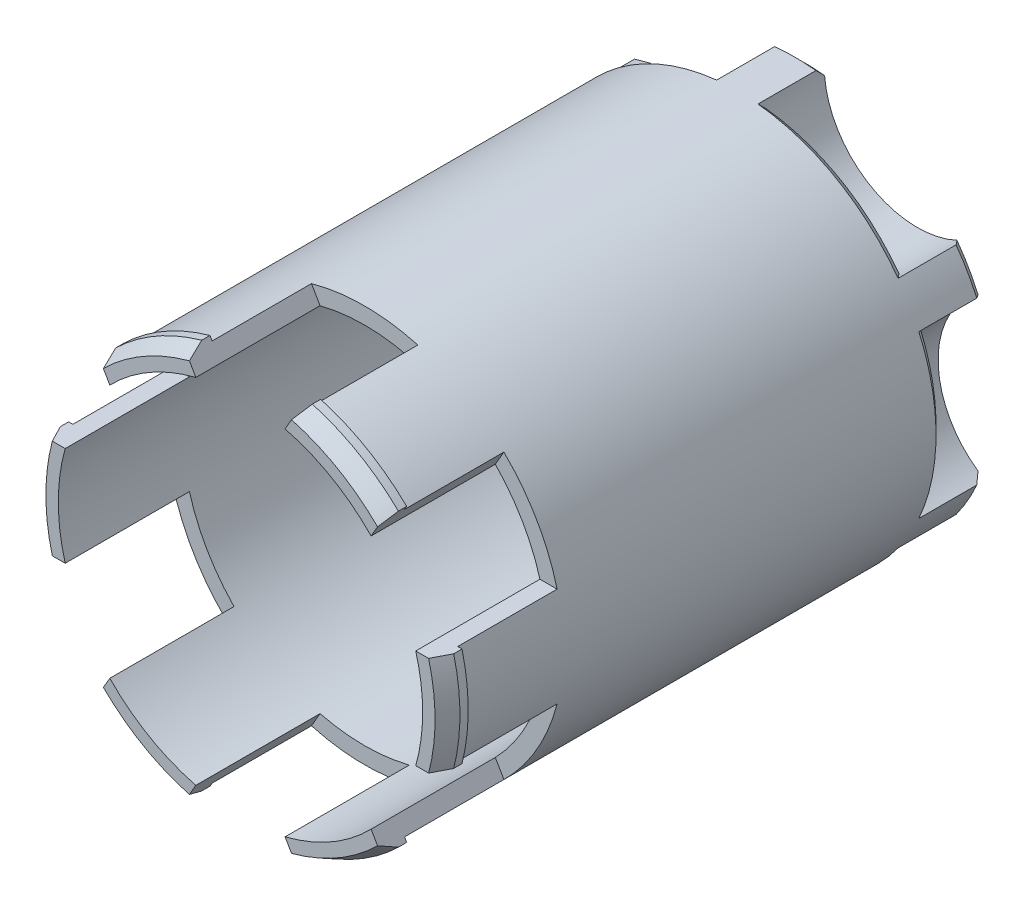
from build123d import *

# Parameters (mm, degrees)
BOSS_EXTRUDE1_DEPTH      = 2.9999999999999933
BOSS_EXTRUDE1_DEPTH_BACK = 43
BOSS_EXTRUDE2_START      = -43
SKETCH1_5_R              = 22.000000000000007
BOSS_EXTRUDE2_DEPTH      = 2
BOSS_EXTRUDE4_START      = -48
BOSS_EXTRUDE4_DEPTH      = 5
BOSS_EXTRUDE5_START      = -50
BOSS_EXTRUDE5_DEPTH      = 2
CHAMFER1_SIZE            = 1
BOSS_EXTRUDE6_START      = 3
BOSS_EXTRUDE6_DEPTH      = 15
BOSS_EXTRUDE7_START      = 15
BOSS_EXTRUDE7_DEPTH      = 3
CHAMFER2_SIZE            = 2
CHAMFER2_SIZE_2          = 1


with BuildPart() as part:
    # Sketch1 → Boss-Extrude1 (new, two sides: drawn at the far end of the back side and taken through both)
    with BuildSketch(Plane.XY.offset(-BOSS_EXTRUDE1_DEPTH_BACK)):
        with BuildLine():
            ThreePointArc((20.24886363636362, 8.601367416635062), (20.748246379007643, 7.315071578323524), (21.166010488516733, 6.000000000000002))
            Line((21.16601048851673, 6), (23.23790007724409, 6))
            ThreePointArc((23.237900077244284, 6.000000000000867), (22.65827130919298, 7.912189411218785), (21.921590909090916, 9.769536939612994))
            ThreePointArc((21.921590909090916, 9.769536939612994), (21.05869080456737, 9.223450322348732), (20.248863636363723, 8.601367416635078))
        make_face()
        with BuildLine():
            Line((23.23790007724409, 6), (21.16601048851673, 6))
            ThreePointArc((21.166010488516733, 6.000000000000002), (21.79050516563772, 3.0288421263439984), (22.000000000000007, 0))
            ThreePointArc((22.000000000000007, -5.39e-15), (21.79050516563772, -3.028842126344007), (21.16601048851673, -6.000000000000013))
            Line((21.16601048851673, -6), (23.23790007724408, -6))
            ThreePointArc((23.237900077244277, -6.000000000000899), (23.80871271041195, -3.0241030195859375), (24.000000000000007, -5.88e-15))
            ThreePointArc((24.000000000000007, 0), (23.808712710411953, 3.0241030195859184), (23.237900077244284, 6.000000000000867))
        make_face()
        with BuildLine():
            Line((23.23790007724408, -6), (21.16601048851673, -6))
            ThreePointArc((21.16601048851673, -6.000000000000013), (20.74824637900764, -7.3150715783235265), (20.248863636363623, -8.601367416635055))
            ThreePointArc((20.248863636363723, -8.601367416635075), (21.058690804567362, -9.223450322348729), (21.921590909090916, -9.769536939612994))
            ThreePointArc((21.921590909090913, -9.769536939613007), (22.65827130919297, -7.912189411218819), (23.237900077244277, -6.000000000000899))
        make_face()
        with BuildLine():
            ThreePointArc((21.921590909090916, -9.769536939612994), (21.058690804567362, -9.223450322348729), (20.248863636363723, -8.601367416635075))
            ThreePointArc((20.248863636363623, -8.601367416635055), (19.825043296442324, -9.53769669753592), (19.357954545454554, -10.453209833162045))
            ThreePointArc((19.357954545454554, -10.453209833162045), (19.05255888325766, -10.999999999999996), (18.7317225393349, -11.53787548508707))
            ThreePointArc((18.7317225393349, -11.53787548508707), (18.172409281878213, -12.400142777077484), (17.57343450827152, -13.23534659854029))
            ThreePointArc((17.573434508271625, -13.235346598540406), (18.517087691981484, -13.625636046022741), (19.42146262746079, -14.099886148836239))
            ThreePointArc((19.421462627460784, -14.099886148836251), (20.784609690826528, -12.000000000000014), (21.921590909090913, -9.769536939613007))
        make_face()
        with BuildLine():
            ThreePointArc((16.81510246132865, -17.124611797498346), (18.181292684265788, -15.666543853992295), (19.421462627460784, -14.099886148836251))
            ThreePointArc((19.42146262746079, -14.099886148836239), (18.517087691981484, -13.625636046022741), (17.573434508271625, -13.235346598540406))
            ThreePointArc((17.57343450827152, -13.23534659854029), (16.709161006833533, -14.310972659037333), (15.779157666964993, -15.330302779823374))
            Line((15.779157666964998, -15.33030277982336), (16.815102461328966, -17.12461179749825))
        make_face()
        with BuildLine():
            ThreePointArc((6.422797615915619, -23.124611797498115), (11.999999999999858, -20.784609690826617), (16.81510246132865, -17.124611797498346))
            Line((16.815102461328966, -17.12461179749825), (15.779157666964998, -15.33030277982336))
            ThreePointArc((15.779157666964993, -15.330302779823374), (10.99999999999999, -19.052558883257664), (5.386852821551727, -21.330302779823366))
            Line((5.386852821551734, -21.330302779823363), (6.422797615915627, -23.124611797498115))
        make_face()
        with BuildLine():
            ThreePointArc((5.386852821551727, -21.330302779823366), (4.039085372174182, -21.62604423736086), (2.6754291280922486, -21.836714015175357))
            ThreePointArc((2.675429128092201, -21.83671401517523), (2.541603112585925, -22.84908636837134), (2.500128281630129, -23.869423088449235))
            ThreePointArc((2.50012828163012, -23.86942308844924), (4.476978624927215, -23.57873326521052), (6.422797615915619, -23.124611797498115))
            Line((6.422797615915627, -23.124611797498115), (5.386852821551734, -21.330302779823363))
        make_face()
        with BuildLine():
            ThreePointArc((2.6754291280922486, -21.836714015175357), (1.6526340145641762, -21.937839474613394), (0.6262320061196591, -21.991085318249112))
            ThreePointArc((0.6262320061196591, -21.991085318249112), (-4.04e-15, -22.000000000000007), (-0.6262320061196476, -21.991085318249112))
            ThreePointArc((-0.6262320061196476, -21.991085318249112), (-1.6526340145641842, -21.937839474613394), (-2.6754291280922375, -21.83671401517536))
            ThreePointArc((-2.675429128092187, -21.836714015175232), (-2.541603112585914, -22.84908636837135), (-2.5001282816301167, -23.869423088449242))
            ThreePointArc((-2.5001282816301282, -23.869423088449235), (-4.41e-15, -24.000000000000007), (2.50012828163012, -23.86942308844924))
            ThreePointArc((2.500128281630129, -23.869423088449235), (2.541603112585925, -22.84908636837134), (2.675429128092201, -21.83671401517523))
        make_face()
        with BuildLine():
            ThreePointArc((-2.5001282816301167, -23.869423088449242), (-2.541603112585914, -22.84908636837135), (-2.675429128092187, -21.836714015175232))
            ThreePointArc((-2.6754291280922375, -21.83671401517536), (-4.03908537217419, -21.62604423736086), (-5.386852821551735, -21.330302779823366))
            Line((-5.386852821551729, -21.330302779823366), (-6.422797615915622, -23.124611797498122))
            ThreePointArc((-6.422797615915628, -23.124611797498112), (-4.476978624927224, -23.57873326521052), (-2.5001282816301282, -23.869423088449235))
        make_face()
        with BuildLine():
            ThreePointArc((-16.815102461328664, -17.124611797498336), (-11.999999999999865, -20.784609690826613), (-6.422797615915628, -23.124611797498112))
            Line((-6.422797615915622, -23.124611797498122), (-5.386852821551729, -21.330302779823366))
            ThreePointArc((-5.386852821551735, -21.330302779823366), (-10.999999999999995, -19.05255888325766), (-15.779157666964997, -15.330302779823368))
            Line((-15.779157666964991, -15.330302779823372), (-16.81510246132896, -17.12461179749825))
        make_face()
        with BuildLine():
            ThreePointArc((-15.779157666964997, -15.330302779823368), (-16.709161006833533, -14.310972659037335), (-17.573434508271525, -13.23534659854028))
            ThreePointArc((-17.573434508271625, -13.235346598540415), (-18.517087691981477, -13.625636046022748), (-19.42146262746078, -14.099886148836244))
            ThreePointArc((-19.42146262746079, -14.099886148836244), (-18.181292684265806, -15.666543853992271), (-16.815102461328664, -17.124611797498336))
            Line((-16.81510246132896, -17.12461179749825), (-15.779157666964991, -15.330302779823372))
        make_face()
        with BuildLine():
            ThreePointArc((-17.573434508271525, -13.23534659854028), (-18.17240928187822, -12.40014277707747), (-18.731722539334903, -11.537875485087064))
            ThreePointArc((-18.731722539334903, -11.537875485087064), (-19.052558883257657, -11.000000000000005), (-19.357954545454554, -10.453209833162047))
            ThreePointArc((-19.357954545454554, -10.453209833162047), (-19.825043296442328, -9.537696697535912), (-20.24886363636362, -8.601367416635066))
            ThreePointArc((-20.248863636363723, -8.601367416635082), (-21.058690804567366, -9.223450322348736), (-21.921590909090916, -9.769536939612998))
            ThreePointArc((-21.92159090909092, -9.76953693961299), (-20.78460969082653, -12.000000000000007), (-19.42146262746079, -14.099886148836244))
            ThreePointArc((-19.42146262746078, -14.099886148836244), (-18.517087691981477, -13.625636046022748), (-17.573434508271625, -13.235346598540415))
        make_face()
        with BuildLine():
            Line((-21.16601048851673, -6.000000000000003), (-23.237900077244564, -6.000000000000003))
            ThreePointArc((-23.23790007724454, -5.999999999999878), (-22.658271309193147, -7.912189411218307), (-21.92159090909092, -9.76953693961299))
            ThreePointArc((-21.921590909090916, -9.769536939612998), (-21.058690804567366, -9.223450322348736), (-20.248863636363723, -8.601367416635082))
            ThreePointArc((-20.24886363636362, -8.601367416635066), (-20.74824637900764, -7.315071578323528), (-21.16601048851673, -6.000000000000006))
        make_face()
        with BuildLine():
            Line((-21.16601048851673, 5.999999999999997), (-23.237900077244568, 5.999999999999997))
            ThreePointArc((-23.23790007724454, 5.9999999999998845), (-24.000000000000007, 2.94e-15), (-23.23790007724454, -5.999999999999878))
            Line((-23.237900077244564, -6.000000000000003), (-21.16601048851673, -6.000000000000003))
            ThreePointArc((-21.16601048851673, -6.000000000000006), (-22.000000000000007, 2.69e-15), (-21.166010488516733, 6.000000000000002))
        make_face()
        with BuildLine():
            ThreePointArc((-21.921590909090916, 9.769536939612996), (-22.658271309193143, 7.912189411218312), (-23.23790007724454, 5.9999999999998845))
            Line((-23.237900077244568, 5.999999999999997), (-21.16601048851673, 5.999999999999997))
            ThreePointArc((-21.166010488516733, 6.000000000000002), (-20.748246379007643, 7.315071578323524), (-20.24886363636362, 8.60136741663506))
            ThreePointArc((-20.248863636363726, 8.601367416635076), (-21.05869080456737, 9.223450322348729), (-21.921590909090916, 9.76953693961299))
        make_face()
        with BuildLine():
            ThreePointArc((-19.357954545454554, 10.453209833162044), (-19.052558883257664, 10.999999999999993), (-18.73172253933491, 11.537875485087051))
            ThreePointArc((-18.73172253933491, 11.537875485087051), (-18.172409281878224, 12.400142777077468), (-17.57343450827153, 13.235346598540279))
            ThreePointArc((-17.57343450827163, 13.235346598540403), (-18.51708769198149, 13.625636046022736), (-19.421462627460798, 14.099886148836234))
            ThreePointArc((-19.421462627460798, 14.099886148836234), (-20.78460969082654, 11.999999999999993), (-21.921590909090916, 9.769536939612996))
            ThreePointArc((-21.921590909090916, 9.76953693961299), (-21.05869080456737, 9.223450322348729), (-20.248863636363726, 8.601367416635076))
            ThreePointArc((-20.24886363636362, 8.60136741663506), (-19.825043296442324, 9.537696697535917), (-19.357954545454554, 10.453209833162044))
        make_face()
        with BuildLine():
            Line((-15.779157666965002, 15.33030277982336), (-16.81510246132897, 17.12461179749824))
            ThreePointArc((-16.815102461328664, 17.12461179749833), (-18.18129268426581, 15.666543853992268), (-19.421462627460798, 14.099886148836234))
            ThreePointArc((-19.421462627460798, 14.099886148836234), (-18.51708769198149, 13.625636046022736), (-17.57343450827163, 13.235346598540403))
            ThreePointArc((-17.57343450827153, 13.235346598540279), (-16.709161006833533, 14.310972659037333), (-15.779157666965, 15.330302779823363))
        make_face()
        with BuildLine():
            Line((-5.386852821551742, 21.330302779823363), (-6.42279761591554, 23.124611797497952))
            ThreePointArc((-6.4227976159152576, 23.124611797498215), (-11.999999999999703, 20.784609690826706), (-16.815102461328664, 17.12461179749833))
            Line((-16.81510246132897, 17.12461179749824), (-15.779157666965002, 15.33030277982336))
            ThreePointArc((-15.779157666965, 15.330302779823363), (-11.000000000000009, 19.052558883257653), (-5.386852821551744, 21.330302779823363))
        make_face()
        with BuildLine():
            ThreePointArc((-2.500128281630133, 23.869423088449235), (-4.47697862492704, 23.578733265210552), (-6.4227976159152576, 23.124611797498215))
            Line((-6.42279761591554, 23.124611797497952), (-5.386852821551742, 21.330302779823363))
            ThreePointArc((-5.386852821551744, 21.330302779823363), (-4.039085372174195, 21.62604423736086), (-2.675429128092256, 21.836714015175357))
            ThreePointArc((-2.6754291280922082, 21.836714015175225), (-2.541603112585932, 22.849086368371346), (-2.5001282816301362, 23.869423088449242))
        make_face()
        with BuildLine():
            ThreePointArc((-0.6262320061196618, 21.991085318249112), (-1.819e-14, 22.000000000000007), (0.6262320061196303, 21.991085318249112))
            ThreePointArc((0.6262320061196303, 21.991085318249112), (1.6526340145641618, 21.937839474613398), (2.6754291280922247, 21.83671401517536))
            ThreePointArc((2.6754291280921745, 21.836714015175232), (2.5416031125859018, 22.849086368371346), (2.5001282816301043, 23.86942308844924))
            ThreePointArc((2.5001282816301043, 23.86942308844924), (-1.452e-14, 24.000000000000007), (-2.500128281630133, 23.869423088449235))
            ThreePointArc((-2.5001282816301362, 23.869423088449242), (-2.541603112585932, 22.849086368371346), (-2.6754291280922082, 21.836714015175225))
            ThreePointArc((-2.675429128092256, 21.836714015175357), (-1.6526340145641885, 21.937839474613394), (-0.6262320061196618, 21.991085318249112))
        make_face()
        with BuildLine():
            Line((5.386852821551717, 21.330302779823366), (6.422797615915513, 23.12461179749796))
            ThreePointArc((6.42279761591523, 23.124611797498222), (4.476978624927011, 23.57873326521056), (2.5001282816301043, 23.86942308844924))
            ThreePointArc((2.5001282816301043, 23.86942308844924), (2.5416031125859018, 22.849086368371346), (2.6754291280921745, 21.836714015175232))
            ThreePointArc((2.6754291280922247, 21.83671401517536), (4.039085372174168, 21.626044237360865), (5.386852821551718, 21.33030277982337))
        make_face()
        with BuildLine():
            Line((15.779157666964986, 15.330302779823379), (16.815102461328948, 17.124611797498257))
            ThreePointArc((16.815102461328642, 17.124611797498353), (11.999999999999678, 20.78460969082672), (6.42279761591523, 23.124611797498222))
            Line((6.422797615915513, 23.12461179749796), (5.386852821551717, 21.330302779823366))
            ThreePointArc((5.386852821551718, 21.33030277982337), (10.99999999999999, 19.052558883257664), (15.779157666964984, 15.33030277982338))
        make_face()
        with BuildLine():
            ThreePointArc((17.573434508271614, 13.235346598540424), (18.517087691981473, 13.625636046022757), (19.421462627460777, 14.099886148836253))
            ThreePointArc((19.421462627460784, 14.099886148836255), (18.18129268426579, 15.66654385399229), (16.815102461328642, 17.124611797498353))
            Line((16.815102461328948, 17.124611797498257), (15.779157666964986, 15.330302779823379))
            ThreePointArc((15.779157666964984, 15.33030277982338), (16.709161006833522, 14.310972659037347), (17.573434508271514, 13.235346598540298))
        make_face()
        with BuildLine():
            ThreePointArc((19.357954545454554, 10.453209833162049), (19.825043296442324, 9.537696697535916), (20.24886363636362, 8.601367416635062))
            ThreePointArc((20.248863636363723, 8.601367416635078), (21.05869080456737, 9.223450322348732), (21.921590909090916, 9.769536939612994))
            ThreePointArc((21.921590909090916, 9.769536939612994), (20.784609690826528, 12.000000000000009), (19.421462627460784, 14.099886148836255))
            ThreePointArc((19.421462627460777, 14.099886148836253), (18.517087691981473, 13.625636046022757), (17.573434508271614, 13.235346598540424))
            ThreePointArc((17.573434508271514, 13.235346598540298), (18.17240928187821, 12.40014277707749), (18.731722539334893, 11.537875485087083))
            ThreePointArc((18.731722539334893, 11.537875485087083), (19.05255888325765, 11.000000000000014), (19.357954545454554, 10.453209833162049))
        make_face()
    extrude(amount=BOSS_EXTRUDE1_DEPTH + BOSS_EXTRUDE1_DEPTH_BACK)

    # Sketch1<5> → Boss-Extrude2 (add)
    with BuildSketch(Plane.XY.offset(BOSS_EXTRUDE2_START)):
        Circle(SKETCH1_5_R)
    extrude(amount=BOSS_EXTRUDE2_DEPTH)

    # Sketch1<7> → Boss-Extrude4 (add)
    with BuildSketch(Plane.XY.offset(BOSS_EXTRUDE4_START)):
        with BuildLine():
            ThreePointArc((-18.73172253933491, 11.537875485087053), (-7.125000000000005, 12.340862003928246), (-0.6262320061196593, 21.991085318249112))
            ThreePointArc((-0.6262320061196618, 21.991085318249112), (-1.6526340145641885, 21.937839474613394), (-2.675429128092256, 21.836714015175357))
            ThreePointArc((-2.6754291280922082, 21.836714015175225), (-8.12500000000014, 14.072912811497051), (-17.57343450827163, 13.235346598540403))
            ThreePointArc((-17.57343450827153, 13.235346598540279), (-18.172409281878224, 12.400142777077468), (-18.73172253933491, 11.537875485087051))
        make_face()
        with BuildLine():
            ThreePointArc((-19.357954545454554, 10.453209833162044), (-19.052558883257664, 10.999999999999993), (-18.73172253933491, 11.537875485087051))
            ThreePointArc((-18.73172253933491, 11.537875485087051), (-18.172409281878224, 12.400142777077468), (-17.57343450827153, 13.235346598540279))
            ThreePointArc((-17.57343450827163, 13.235346598540403), (-18.51708769198149, 13.625636046022736), (-19.421462627460798, 14.099886148836234))
            ThreePointArc((-19.421462627460798, 14.099886148836234), (-20.78460969082654, 11.999999999999993), (-21.921590909090916, 9.769536939612996))
            ThreePointArc((-21.921590909090916, 9.76953693961299), (-21.05869080456737, 9.223450322348729), (-20.248863636363726, 8.601367416635076))
            ThreePointArc((-20.24886363636362, 8.60136741663506), (-19.825043296442324, 9.537696697535917), (-19.357954545454554, 10.453209833162044))
        make_face()
        with BuildLine():
            ThreePointArc((-19.35795454545455, -10.453209833162049), (-14.250000000000005, -1.78e-15), (-19.35795454545455, 10.453209833162044))
            ThreePointArc((-19.357954545454554, 10.453209833162044), (-19.825043296442324, 9.537696697535917), (-20.24886363636362, 8.60136741663506))
            ThreePointArc((-20.248863636363726, 8.601367416635076), (-16.250000000000007, -2.66e-15), (-20.248863636363723, -8.601367416635082))
            ThreePointArc((-20.24886363636362, -8.601367416635066), (-19.825043296442328, -9.537696697535912), (-19.357954545454554, -10.453209833162047))
        make_face()
        with BuildLine():
            ThreePointArc((-17.573434508271525, -13.23534659854028), (-18.17240928187822, -12.40014277707747), (-18.731722539334903, -11.537875485087064))
            ThreePointArc((-18.731722539334903, -11.537875485087064), (-19.052558883257657, -11.000000000000005), (-19.357954545454554, -10.453209833162047))
            ThreePointArc((-19.357954545454554, -10.453209833162047), (-19.825043296442328, -9.537696697535912), (-20.24886363636362, -8.601367416635066))
            ThreePointArc((-20.248863636363723, -8.601367416635082), (-21.058690804567366, -9.223450322348736), (-21.921590909090916, -9.769536939612998))
            ThreePointArc((-21.92159090909092, -9.76953693961299), (-20.78460969082653, -12.000000000000007), (-19.42146262746079, -14.099886148836244))
            ThreePointArc((-19.42146262746078, -14.099886148836244), (-18.517087691981477, -13.625636046022748), (-17.573434508271625, -13.235346598540415))
        make_face()
        with BuildLine():
            ThreePointArc((-2.6754291280922375, -21.83671401517536), (-1.6526340145641842, -21.937839474613394), (-0.6262320061196476, -21.991085318249112))
            ThreePointArc((-0.6262320061196451, -21.99108531824911), (-7.124999999999997, -12.340862003928255), (-18.731722539334896, -11.537875485087065))
            ThreePointArc((-18.731722539334903, -11.537875485087064), (-18.17240928187822, -12.40014277707747), (-17.573434508271525, -13.23534659854028))
            ThreePointArc((-17.57343450827162, -13.235346598540415), (-8.125000000000126, -14.072912811497059), (-2.675429128092187, -21.836714015175232))
        make_face()
        with BuildLine():
            ThreePointArc((2.6754291280922486, -21.836714015175357), (1.6526340145641762, -21.937839474613394), (0.6262320061196591, -21.991085318249112))
            ThreePointArc((0.6262320061196591, -21.991085318249112), (-4.04e-15, -22.000000000000007), (-0.6262320061196476, -21.991085318249112))
            ThreePointArc((-0.6262320061196476, -21.991085318249112), (-1.6526340145641842, -21.937839474613394), (-2.6754291280922375, -21.83671401517536))
            ThreePointArc((-2.675429128092187, -21.836714015175232), (-2.541603112585914, -22.84908636837135), (-2.5001282816301167, -23.869423088449242))
            ThreePointArc((-2.5001282816301282, -23.869423088449235), (-4.41e-15, -24.000000000000007), (2.50012828163012, -23.86942308844924))
            ThreePointArc((2.500128281630129, -23.869423088449235), (2.541603112585925, -22.84908636837134), (2.675429128092201, -21.83671401517523))
        make_face()
        with BuildLine():
            ThreePointArc((17.57343450827152, -13.23534659854029), (18.172409281878213, -12.400142777077484), (18.7317225393349, -11.53787548508707))
            ThreePointArc((18.731722539334903, -11.537875485087064), (7.125000000000007, -12.340862003928255), (0.6262320061196558, -21.99108531824911))
            ThreePointArc((0.6262320061196591, -21.991085318249112), (1.6526340145641762, -21.937839474613394), (2.6754291280922486, -21.836714015175357))
            ThreePointArc((2.675429128092201, -21.83671401517523), (8.125000000000135, -14.072912811497059), (17.573434508271625, -13.235346598540406))
        make_face()
        with BuildLine():
            ThreePointArc((21.921590909090916, -9.769536939612994), (21.058690804567362, -9.223450322348729), (20.248863636363723, -8.601367416635075))
            ThreePointArc((20.248863636363623, -8.601367416635055), (19.825043296442324, -9.53769669753592), (19.357954545454554, -10.453209833162045))
            ThreePointArc((19.357954545454554, -10.453209833162045), (19.05255888325766, -10.999999999999996), (18.7317225393349, -11.53787548508707))
            ThreePointArc((18.7317225393349, -11.53787548508707), (18.172409281878213, -12.400142777077484), (17.57343450827152, -13.23534659854029))
            ThreePointArc((17.573434508271625, -13.235346598540406), (18.517087691981484, -13.625636046022741), (19.42146262746079, -14.099886148836239))
            ThreePointArc((19.421462627460784, -14.099886148836251), (20.784609690826528, -12.000000000000014), (21.921590909090913, -9.769536939613007))
        make_face()
        with BuildLine():
            ThreePointArc((20.248863636363723, -8.601367416635076), (16.250000000000007, 3.11e-15), (20.248863636363723, 8.601367416635078))
            ThreePointArc((20.24886363636362, 8.601367416635062), (19.825043296442324, 9.537696697535916), (19.357954545454554, 10.453209833162049))
            ThreePointArc((19.35795454545455, 10.453209833162047), (14.25, -8.9e-16), (19.357954545454554, -10.453209833162045))
            ThreePointArc((19.357954545454554, -10.453209833162045), (19.825043296442324, -9.53769669753592), (20.248863636363623, -8.601367416635055))
        make_face()
        with BuildLine():
            ThreePointArc((19.357954545454554, 10.453209833162049), (19.825043296442324, 9.537696697535916), (20.24886363636362, 8.601367416635062))
            ThreePointArc((20.248863636363723, 8.601367416635078), (21.05869080456737, 9.223450322348732), (21.921590909090916, 9.769536939612994))
            ThreePointArc((21.921590909090916, 9.769536939612994), (20.784609690826528, 12.000000000000009), (19.421462627460784, 14.099886148836255))
            ThreePointArc((19.421462627460777, 14.099886148836253), (18.517087691981473, 13.625636046022757), (17.573434508271614, 13.235346598540424))
            ThreePointArc((17.573434508271514, 13.235346598540298), (18.17240928187821, 12.40014277707749), (18.731722539334893, 11.537875485087083))
            ThreePointArc((18.731722539334893, 11.537875485087083), (19.05255888325765, 11.000000000000014), (19.357954545454554, 10.453209833162049))
        make_face()
        with BuildLine():
            ThreePointArc((0.6262320061196309, 21.99108531824911), (7.124999999999991, 12.340862003928262), (18.73172253933489, 11.53787548508708))
            ThreePointArc((18.731722539334893, 11.537875485087083), (18.17240928187821, 12.40014277707749), (17.573434508271514, 13.235346598540298))
            ThreePointArc((17.573434508271614, 13.235346598540424), (8.125000000000117, 14.072912811497062), (2.6754291280921745, 21.836714015175232))
            ThreePointArc((2.6754291280922247, 21.83671401517536), (1.6526340145641618, 21.937839474613398), (0.6262320061196303, 21.991085318249112))
        make_face()
        with BuildLine():
            ThreePointArc((-0.6262320061196618, 21.991085318249112), (-1.819e-14, 22.000000000000007), (0.6262320061196303, 21.991085318249112))
            ThreePointArc((0.6262320061196303, 21.991085318249112), (1.6526340145641618, 21.937839474613398), (2.6754291280922247, 21.83671401517536))
            ThreePointArc((2.6754291280921745, 21.836714015175232), (2.5416031125859018, 22.849086368371346), (2.5001282816301043, 23.86942308844924))
            ThreePointArc((2.5001282816301043, 23.86942308844924), (-1.452e-14, 24.000000000000007), (-2.500128281630133, 23.869423088449235))
            ThreePointArc((-2.5001282816301362, 23.869423088449242), (-2.541603112585932, 22.849086368371346), (-2.6754291280922082, 21.836714015175225))
            ThreePointArc((-2.675429128092256, 21.836714015175357), (-1.6526340145641885, 21.937839474613394), (-0.6262320061196618, 21.991085318249112))
        make_face()
    extrude(amount=BOSS_EXTRUDE4_DEPTH)

    # Sketch1<8> → Boss-Extrude5 (add)
    with BuildSketch(Plane.XY.offset(BOSS_EXTRUDE5_START)):
        with BuildLine():
            ThreePointArc((-18.73172253933491, 11.537875485087053), (-7.125000000000005, 12.340862003928246), (-0.6262320061196593, 21.991085318249112))
            ThreePointArc((-0.6262320061196618, 21.991085318249112), (-1.6526340145641885, 21.937839474613394), (-2.675429128092256, 21.836714015175357))
            ThreePointArc((-2.6754291280922082, 21.836714015175225), (-8.12500000000014, 14.072912811497051), (-17.57343450827163, 13.235346598540403))
            ThreePointArc((-17.57343450827153, 13.235346598540279), (-18.172409281878224, 12.400142777077468), (-18.73172253933491, 11.537875485087051))
        make_face()
        with BuildLine():
            ThreePointArc((-0.6262320061196618, 21.991085318249112), (-1.819e-14, 22.000000000000007), (0.6262320061196303, 21.991085318249112))
            ThreePointArc((0.6262320061196303, 21.991085318249112), (1.6526340145641618, 21.937839474613398), (2.6754291280922247, 21.83671401517536))
            ThreePointArc((2.6754291280921745, 21.836714015175232), (2.5416031125859018, 22.849086368371346), (2.5001282816301043, 23.86942308844924))
            ThreePointArc((2.5001282816301043, 23.86942308844924), (-1.452e-14, 24.000000000000007), (-2.500128281630133, 23.869423088449235))
            ThreePointArc((-2.5001282816301362, 23.869423088449242), (-2.541603112585932, 22.849086368371346), (-2.6754291280922082, 21.836714015175225))
            ThreePointArc((-2.675429128092256, 21.836714015175357), (-1.6526340145641885, 21.937839474613394), (-0.6262320061196618, 21.991085318249112))
        make_face()
        with BuildLine():
            ThreePointArc((0.6262320061196309, 21.99108531824911), (7.124999999999991, 12.340862003928262), (18.73172253933489, 11.53787548508708))
            ThreePointArc((18.731722539334893, 11.537875485087083), (18.17240928187821, 12.40014277707749), (17.573434508271514, 13.235346598540298))
            ThreePointArc((17.573434508271614, 13.235346598540424), (8.125000000000117, 14.072912811497062), (2.6754291280921745, 21.836714015175232))
            ThreePointArc((2.6754291280922247, 21.83671401517536), (1.6526340145641618, 21.937839474613398), (0.6262320061196303, 21.991085318249112))
        make_face()
        with BuildLine():
            ThreePointArc((19.357954545454554, -10.453209833162045), (14.25, -8.9e-16), (19.35795454545455, 10.453209833162047))
            ThreePointArc((19.357954545454554, 10.453209833162049), (19.05255888325765, 11.000000000000014), (18.731722539334893, 11.537875485087083))
            ThreePointArc((18.73172253933489, 11.53787548508708), (7.124999999999991, 12.340862003928262), (0.6262320061196309, 21.99108531824911))
            ThreePointArc((0.6262320061196303, 21.991085318249112), (-1.819e-14, 22.000000000000007), (-0.6262320061196618, 21.991085318249112))
            ThreePointArc((-0.6262320061196593, 21.991085318249112), (-7.125000000000005, 12.340862003928246), (-18.73172253933491, 11.537875485087053))
            ThreePointArc((-18.73172253933491, 11.537875485087051), (-19.052558883257664, 10.999999999999993), (-19.357954545454554, 10.453209833162044))
            ThreePointArc((-19.35795454545455, 10.453209833162044), (-14.250000000000005, -1.78e-15), (-19.35795454545455, -10.453209833162049))
            ThreePointArc((-19.357954545454554, -10.453209833162047), (-19.052558883257657, -11.000000000000005), (-18.731722539334903, -11.537875485087064))
            ThreePointArc((-18.731722539334896, -11.537875485087065), (-7.124999999999997, -12.340862003928255), (-0.6262320061196451, -21.99108531824911))
            ThreePointArc((-0.6262320061196476, -21.991085318249112), (-4.04e-15, -22.000000000000007), (0.6262320061196591, -21.991085318249112))
            ThreePointArc((0.6262320061196558, -21.99108531824911), (7.125000000000007, -12.340862003928255), (18.731722539334903, -11.537875485087064))
            ThreePointArc((18.7317225393349, -11.53787548508707), (19.05255888325766, -10.999999999999996), (19.357954545454554, -10.453209833162045))
        make_face()
        with BuildLine():
            ThreePointArc((20.248863636363723, -8.601367416635076), (16.250000000000007, 3.11e-15), (20.248863636363723, 8.601367416635078))
            ThreePointArc((20.24886363636362, 8.601367416635062), (19.825043296442324, 9.537696697535916), (19.357954545454554, 10.453209833162049))
            ThreePointArc((19.35795454545455, 10.453209833162047), (14.25, -8.9e-16), (19.357954545454554, -10.453209833162045))
            ThreePointArc((19.357954545454554, -10.453209833162045), (19.825043296442324, -9.53769669753592), (20.248863636363623, -8.601367416635055))
        make_face()
        with BuildLine():
            ThreePointArc((19.357954545454554, 10.453209833162049), (19.825043296442324, 9.537696697535916), (20.24886363636362, 8.601367416635062))
            ThreePointArc((20.248863636363723, 8.601367416635078), (21.05869080456737, 9.223450322348732), (21.921590909090916, 9.769536939612994))
            ThreePointArc((21.921590909090916, 9.769536939612994), (20.784609690826528, 12.000000000000009), (19.421462627460784, 14.099886148836255))
            ThreePointArc((19.421462627460777, 14.099886148836253), (18.517087691981473, 13.625636046022757), (17.573434508271614, 13.235346598540424))
            ThreePointArc((17.573434508271514, 13.235346598540298), (18.17240928187821, 12.40014277707749), (18.731722539334893, 11.537875485087083))
            ThreePointArc((18.731722539334893, 11.537875485087083), (19.05255888325765, 11.000000000000014), (19.357954545454554, 10.453209833162049))
        make_face()
        with BuildLine():
            ThreePointArc((21.921590909090916, -9.769536939612994), (21.058690804567362, -9.223450322348729), (20.248863636363723, -8.601367416635075))
            ThreePointArc((20.248863636363623, -8.601367416635055), (19.825043296442324, -9.53769669753592), (19.357954545454554, -10.453209833162045))
            ThreePointArc((19.357954545454554, -10.453209833162045), (19.05255888325766, -10.999999999999996), (18.7317225393349, -11.53787548508707))
            ThreePointArc((18.7317225393349, -11.53787548508707), (18.172409281878213, -12.400142777077484), (17.57343450827152, -13.23534659854029))
            ThreePointArc((17.573434508271625, -13.235346598540406), (18.517087691981484, -13.625636046022741), (19.42146262746079, -14.099886148836239))
            ThreePointArc((19.421462627460784, -14.099886148836251), (20.784609690826528, -12.000000000000014), (21.921590909090913, -9.769536939613007))
        make_face()
        with BuildLine():
            ThreePointArc((17.57343450827152, -13.23534659854029), (18.172409281878213, -12.400142777077484), (18.7317225393349, -11.53787548508707))
            ThreePointArc((18.731722539334903, -11.537875485087064), (7.125000000000007, -12.340862003928255), (0.6262320061196558, -21.99108531824911))
            ThreePointArc((0.6262320061196591, -21.991085318249112), (1.6526340145641762, -21.937839474613394), (2.6754291280922486, -21.836714015175357))
            ThreePointArc((2.675429128092201, -21.83671401517523), (8.125000000000135, -14.072912811497059), (17.573434508271625, -13.235346598540406))
        make_face()
        with BuildLine():
            ThreePointArc((2.6754291280922486, -21.836714015175357), (1.6526340145641762, -21.937839474613394), (0.6262320061196591, -21.991085318249112))
            ThreePointArc((0.6262320061196591, -21.991085318249112), (-4.04e-15, -22.000000000000007), (-0.6262320061196476, -21.991085318249112))
            ThreePointArc((-0.6262320061196476, -21.991085318249112), (-1.6526340145641842, -21.937839474613394), (-2.6754291280922375, -21.83671401517536))
            ThreePointArc((-2.675429128092187, -21.836714015175232), (-2.541603112585914, -22.84908636837135), (-2.5001282816301167, -23.869423088449242))
            ThreePointArc((-2.5001282816301282, -23.869423088449235), (-4.41e-15, -24.000000000000007), (2.50012828163012, -23.86942308844924))
            ThreePointArc((2.500128281630129, -23.869423088449235), (2.541603112585925, -22.84908636837134), (2.675429128092201, -21.83671401517523))
        make_face()
        with BuildLine():
            ThreePointArc((-2.6754291280922375, -21.83671401517536), (-1.6526340145641842, -21.937839474613394), (-0.6262320061196476, -21.991085318249112))
            ThreePointArc((-0.6262320061196451, -21.99108531824911), (-7.124999999999997, -12.340862003928255), (-18.731722539334896, -11.537875485087065))
            ThreePointArc((-18.731722539334903, -11.537875485087064), (-18.17240928187822, -12.40014277707747), (-17.573434508271525, -13.23534659854028))
            ThreePointArc((-17.57343450827162, -13.235346598540415), (-8.125000000000126, -14.072912811497059), (-2.675429128092187, -21.836714015175232))
        make_face()
        with BuildLine():
            ThreePointArc((-17.573434508271525, -13.23534659854028), (-18.17240928187822, -12.40014277707747), (-18.731722539334903, -11.537875485087064))
            ThreePointArc((-18.731722539334903, -11.537875485087064), (-19.052558883257657, -11.000000000000005), (-19.357954545454554, -10.453209833162047))
            ThreePointArc((-19.357954545454554, -10.453209833162047), (-19.825043296442328, -9.537696697535912), (-20.24886363636362, -8.601367416635066))
            ThreePointArc((-20.248863636363723, -8.601367416635082), (-21.058690804567366, -9.223450322348736), (-21.921590909090916, -9.769536939612998))
            ThreePointArc((-21.92159090909092, -9.76953693961299), (-20.78460969082653, -12.000000000000007), (-19.42146262746079, -14.099886148836244))
            ThreePointArc((-19.42146262746078, -14.099886148836244), (-18.517087691981477, -13.625636046022748), (-17.573434508271625, -13.235346598540415))
        make_face()
        with BuildLine():
            ThreePointArc((-19.35795454545455, -10.453209833162049), (-14.250000000000005, -1.78e-15), (-19.35795454545455, 10.453209833162044))
            ThreePointArc((-19.357954545454554, 10.453209833162044), (-19.825043296442324, 9.537696697535917), (-20.24886363636362, 8.60136741663506))
            ThreePointArc((-20.248863636363726, 8.601367416635076), (-16.250000000000007, -2.66e-15), (-20.248863636363723, -8.601367416635082))
            ThreePointArc((-20.24886363636362, -8.601367416635066), (-19.825043296442328, -9.537696697535912), (-19.357954545454554, -10.453209833162047))
        make_face()
        with BuildLine():
            ThreePointArc((-19.357954545454554, 10.453209833162044), (-19.052558883257664, 10.999999999999993), (-18.73172253933491, 11.537875485087051))
            ThreePointArc((-18.73172253933491, 11.537875485087051), (-18.172409281878224, 12.400142777077468), (-17.57343450827153, 13.235346598540279))
            ThreePointArc((-17.57343450827163, 13.235346598540403), (-18.51708769198149, 13.625636046022736), (-19.421462627460798, 14.099886148836234))
            ThreePointArc((-19.421462627460798, 14.099886148836234), (-20.78460969082654, 11.999999999999993), (-21.921590909090916, 9.769536939612996))
            ThreePointArc((-21.921590909090916, 9.76953693961299), (-21.05869080456737, 9.223450322348729), (-20.248863636363726, 8.601367416635076))
            ThreePointArc((-20.24886363636362, 8.60136741663506), (-19.825043296442324, 9.537696697535917), (-19.357954545454554, 10.453209833162044))
        make_face()
    extrude(amount=BOSS_EXTRUDE5_DEPTH)

    # Chamfer1
    # the kernel refuses this chamfer: 1 mm, written as the material it takes off along each edge
    with BuildSketch(Plane(origin=(-3.3396e-13, -1.8563e-13, -43), x_dir=(0.8674241831056797, 0.4975693786432644, 0), z_dir=(0.4975693786432644, -0.8674241831056797, 0))) as chamfer1_piece_1_section:
        Polygon((24.000000000000373, CHAMFER1_SIZE), (24.000000000000373 - CHAMFER1_SIZE, 0), (24.000000000000373, 0), align=None)
    chamfer1_piece_1 = revolve(axis=Axis((-3.3396e-13, -1.8563e-13, -43), (0, 0, 1)), revolution_arc=60.32135749459976, mode=Mode.PRIVATE)
    chamfer1_piece_1 = chamfer1_piece_1 & Plane(origin=(13.74999999999999, 23.8156986040721, -42.51566627733546), x_dir=(0.5041300113298469, -0.8636277737987405, 0), z_dir=(0, 0, -1)) * Cylinder(11.250000000000021, 97, mode=Mode.PRIVATE)
    add(chamfer1_piece_1, mode=Mode.SUBTRACT)
    with BuildSketch(Plane(origin=(-3.3396e-13, -1.8563e-13, -43), x_dir=(0.0028043695025452846, 0.9999960677481153, 0), z_dir=(0.9999960677481153, -0.0028043695025452846, 0))) as chamfer1_piece_2_section:
        Polygon((23.9999999999994, CHAMFER1_SIZE), (23.9999999999994 - CHAMFER1_SIZE, 0), (23.9999999999994, 0), align=None)
    chamfer1_piece_2 = revolve(axis=Axis((-3.3396e-13, -1.8563e-13, -43), (0, 0, 1)), revolution_arc=60.32135749460013, mode=Mode.PRIVATE)
    chamfer1_piece_2 = chamfer1_piece_2 & Plane(origin=(-13.750000000000016, 23.815698604072065, -42.51566627733705), x_dir=(0.9844062997251383, -0.17590974123527459, 0), z_dir=(0, 0, -1)) * Cylinder(11.250000000000005, 96, mode=Mode.PRIVATE)
    add(chamfer1_piece_2, mode=Mode.SUBTRACT)
    with BuildSketch(Plane(origin=(-3.3396e-13, -1.8563e-13, -43), x_dir=(-0.8646198136031416, 0.5024266891048572, 0), z_dir=(0.5024266891048572, 0.8646198136031416, 0))) as chamfer1_piece_3_section:
        Polygon((23.999999999997844, CHAMFER1_SIZE), (23.999999999997844 - CHAMFER1_SIZE, 0), (23.999999999997844, 0), align=None)
    chamfer1_piece_3 = revolve(axis=Axis((-3.3396e-13, -1.8563e-13, -43), (0, 0, 1)), revolution_arc=60.32135749460074, mode=Mode.PRIVATE)
    chamfer1_piece_3 = chamfer1_piece_3 & Plane(origin=(-27.500000000000206, -2.8866e-13, -42.51566627733547), x_dir=(0.4958585858585883, 0.8684032835211536, 0), z_dir=(0, 0, -1)) * Cylinder(11.250000000000346, 96, mode=Mode.PRIVATE)
    add(chamfer1_piece_3, mode=Mode.SUBTRACT)
    with BuildSketch(Plane(origin=(-3.3396e-13, -1.8563e-13, -43), x_dir=(-0.8674241831056763, -0.4975693786432705, 0), z_dir=(-0.4975693786432705, 0.8674241831056763, 0))) as chamfer1_piece_4_section:
        Polygon((23.999999999997247, CHAMFER1_SIZE), (23.999999999997247 - CHAMFER1_SIZE, 0), (23.999999999997247, 0), align=None)
    chamfer1_piece_4 = revolve(axis=Axis((-3.3396e-13, -1.8563e-13, -43), (0, 0, 1)), revolution_arc=60.32135749460056, mode=Mode.PRIVATE)
    chamfer1_piece_4 = chamfer1_piece_4 & Plane(origin=(-13.750000000000007, -23.815698604072026, -42.51566627733548), x_dir=(-0.5041300113298485, 0.8636277737987396, 0), z_dir=(0, 0, -1)) * Cylinder(11.249999999999956, 96, mode=Mode.PRIVATE)
    add(chamfer1_piece_4, mode=Mode.SUBTRACT)
    with BuildSketch(Plane(origin=(-3.3396e-13, -1.8563e-13, -43), x_dir=(-0.0028043695025176778, -0.9999960677481153, 0), z_dir=(-0.9999960677481153, 0.0028043695025176778, 0))) as chamfer1_piece_5_section:
        Polygon((23.999999999998217, CHAMFER1_SIZE), (23.999999999998217 - CHAMFER1_SIZE, 0), (23.999999999998217, 0), align=None)
    chamfer1_piece_5 = revolve(axis=Axis((-3.3396e-13, -1.8563e-13, -43), (0, 0, 1)), revolution_arc=60.32135749460021, mode=Mode.PRIVATE)
    chamfer1_piece_5 = chamfer1_piece_5 & Plane(origin=(13.750000000000348, -23.815698604072097, -42.51566627733548), x_dir=(-0.9999885971884336, -0.004775509722412147, 0), z_dir=(0, 0, -1)) * Cylinder(11.250000000000343, 96, mode=Mode.PRIVATE)
    add(chamfer1_piece_5, mode=Mode.SUBTRACT)
    with BuildSketch(Plane(origin=(-3.3396e-13, -1.8563e-13, -43), x_dir=(0.8646198136031515, -0.5024266891048397, 0), z_dir=(-0.5024266891048397, -0.8646198136031515, 0))) as chamfer1_piece_6_section:
        Polygon((23.999999999999776, CHAMFER1_SIZE), (23.999999999999776 - CHAMFER1_SIZE, 0), (23.999999999999776, 0), align=None)
    chamfer1_piece_6 = revolve(axis=Axis((-3.3396e-13, -1.8563e-13, -43), (0, 0, 1)), revolution_arc=60.3213574945998, mode=Mode.PRIVATE)
    chamfer1_piece_6 = chamfer1_piece_6 & Plane(origin=(27.499999999999847, -2.4247e-13, -42.51566627733547), x_dir=(-0.49585858585858433, -0.8684032835211558, 0), z_dir=(0, 0, -1)) * Cylinder(11.24999999999971, 96, mode=Mode.PRIVATE)
    add(chamfer1_piece_6, mode=Mode.SUBTRACT)
    with BuildSketch(Plane(origin=(7.2298e-13, -4.1833e-13, -50), x_dir=(-0.7417540735373098, 0.6706719722716965, 0), z_dir=(0.6706719722716965, 0.7417540735373098, 0))) as chamfer1_piece_7:
        Polygon((23.99999999999906, CHAMFER1_SIZE), (23.99999999999906 - CHAMFER1_SIZE, 0), (23.99999999999906, 0), align=None)
    revolve(axis=Axis((7.2298e-13, -4.1833e-13, -50), (0, 0, 1)), revolution_arc=24.237898296861022, mode=Mode.SUBTRACT)
    with BuildSketch(Plane(origin=(2.55e-15, 4.441e-14, -50), x_dir=(0.20994192882485527, 0.9777138571797473, 0), z_dir=(0.9777138571797473, -0.20994192882485527, 0))) as chamfer1_piece_8:
        Polygon((23.999999999999396, CHAMFER1_SIZE), (23.999999999999396 - CHAMFER1_SIZE, 0), (23.999999999999396, 0), align=None)
    revolve(axis=Axis((2.55e-15, 4.441e-14, -50), (0, 0, 1)), revolution_arc=24.237898296862056, mode=Mode.SUBTRACT)
    with BuildSketch(Plane(origin=(-3.3396e-13, -1.8563e-13, -50), x_dir=(0.951696002362159, 0.30704188490804557, 0), z_dir=(0.30704188490804557, -0.951696002362159, 0))) as chamfer1_piece_9:
        Polygon((24.000000000000384, CHAMFER1_SIZE), (24.000000000000384 - CHAMFER1_SIZE, 0), (24.000000000000384, 0), align=None)
    revolve(axis=Axis((-3.3396e-13, -1.8563e-13, -50), (0, 0, 1)), revolution_arc=24.237898296861868, mode=Mode.SUBTRACT)
    with BuildSketch(Plane(origin=(-2.2027e-13, 1.4122e-13, -50), x_dir=(0.7417540735373042, -0.6706719722717027, 0), z_dir=(-0.6706719722717027, -0.7417540735373042, 0))) as chamfer1_piece_10:
        Polygon((23.999999999999638 - CHAMFER1_SIZE, 0), (23.99999999999964, CHAMFER1_SIZE), (23.999999999999638, 0), align=None)
    revolve(axis=Axis((-2.2027e-13, 1.4122e-13, -50), (0, 0, 1)), revolution_arc=24.237898296861843, mode=Mode.SUBTRACT)
    with BuildSketch(Plane(origin=(1.277e-14, -5.4179e-13, -50), x_dir=(-0.20994192882486012, -0.9777138571797463, 0), z_dir=(-0.9777138571797463, 0.20994192882486012, 0))) as chamfer1_piece_11:
        Polygon((23.999999999997655 - CHAMFER1_SIZE, 0), (23.99999999999765, CHAMFER1_SIZE), (23.999999999997655, 0), align=None)
    revolve(axis=Axis((1.277e-14, -5.4179e-13, -50), (0, 0, 1)), revolution_arc=24.23789829686247, mode=Mode.SUBTRACT)
    with BuildSketch(Plane(origin=(5.2047e-13, 3.0553e-13, -50), x_dir=(-0.9516960023621572, -0.3070418849080508, 0), z_dir=(-0.3070418849080508, 0.9516960023621572, 0))) as chamfer1_piece_12:
        Polygon((23.999999999998202 - CHAMFER1_SIZE, 0), (23.999999999998206, CHAMFER1_SIZE), (23.999999999998202, 0), align=None)
    revolve(axis=Axis((5.2047e-13, 3.0553e-13, -50), (0, 0, 1)), revolution_arc=24.237898296861225, mode=Mode.SUBTRACT)

    # Sketch1<9> → Boss-Extrude6 (add)
    with BuildSketch(Plane.XY.offset(BOSS_EXTRUDE6_START)):
        with BuildLine():
            Line((23.23790007724409, 6), (21.16601048851673, 6))
            ThreePointArc((21.166010488516733, 6.000000000000002), (21.79050516563772, 3.0288421263439984), (22.000000000000007, 0))
            ThreePointArc((22.000000000000007, -5.39e-15), (21.79050516563772, -3.028842126344007), (21.16601048851673, -6.000000000000013))
            Line((21.16601048851673, -6), (23.23790007724408, -6))
            ThreePointArc((23.237900077244277, -6.000000000000899), (23.80871271041195, -3.0241030195859375), (24.000000000000007, -5.88e-15))
            ThreePointArc((24.000000000000007, 0), (23.808712710411953, 3.0241030195859184), (23.237900077244284, 6.000000000000867))
        make_face()
        with BuildLine():
            Line((15.779157666964986, 15.330302779823379), (16.815102461328948, 17.124611797498257))
            ThreePointArc((16.815102461328642, 17.124611797498353), (11.999999999999678, 20.78460969082672), (6.42279761591523, 23.124611797498222))
            Line((6.422797615915513, 23.12461179749796), (5.386852821551717, 21.330302779823366))
            ThreePointArc((5.386852821551718, 21.33030277982337), (10.99999999999999, 19.052558883257664), (15.779157666964984, 15.33030277982338))
        make_face()
        with BuildLine():
            Line((-5.386852821551742, 21.330302779823363), (-6.42279761591554, 23.124611797497952))
            ThreePointArc((-6.4227976159152576, 23.124611797498215), (-11.999999999999703, 20.784609690826706), (-16.815102461328664, 17.12461179749833))
            Line((-16.81510246132897, 17.12461179749824), (-15.779157666965002, 15.33030277982336))
            ThreePointArc((-15.779157666965, 15.330302779823363), (-11.000000000000009, 19.052558883257653), (-5.386852821551744, 21.330302779823363))
        make_face()
        with BuildLine():
            Line((-21.16601048851673, 5.999999999999997), (-23.237900077244568, 5.999999999999997))
            ThreePointArc((-23.23790007724454, 5.9999999999998845), (-24.000000000000007, 2.94e-15), (-23.23790007724454, -5.999999999999878))
            Line((-23.237900077244564, -6.000000000000003), (-21.16601048851673, -6.000000000000003))
            ThreePointArc((-21.16601048851673, -6.000000000000006), (-22.000000000000007, 2.69e-15), (-21.166010488516733, 6.000000000000002))
        make_face()
        with BuildLine():
            ThreePointArc((-16.815102461328664, -17.124611797498336), (-11.999999999999865, -20.784609690826613), (-6.422797615915628, -23.124611797498112))
            Line((-6.422797615915622, -23.124611797498122), (-5.386852821551729, -21.330302779823366))
            ThreePointArc((-5.386852821551735, -21.330302779823366), (-10.999999999999995, -19.05255888325766), (-15.779157666964997, -15.330302779823368))
            Line((-15.779157666964991, -15.330302779823372), (-16.81510246132896, -17.12461179749825))
        make_face()
        with BuildLine():
            ThreePointArc((6.422797615915619, -23.124611797498115), (11.999999999999858, -20.784609690826617), (16.81510246132865, -17.124611797498346))
            Line((16.815102461328966, -17.12461179749825), (15.779157666964998, -15.33030277982336))
            ThreePointArc((15.779157666964993, -15.330302779823374), (10.99999999999999, -19.052558883257664), (5.386852821551727, -21.330302779823366))
            Line((5.386852821551734, -21.330302779823363), (6.422797615915627, -23.124611797498115))
        make_face()
    extrude(amount=BOSS_EXTRUDE6_DEPTH)

    # Sketch1<10> → Boss-Extrude7 (add)
    with BuildSketch(Plane.XY.offset(BOSS_EXTRUDE7_START)):
        with BuildLine():
            Line((23.753947040439414, 6), (23.23790007724409, 6))
            ThreePointArc((23.237900077244284, 6.000000000000867), (23.808712710411953, 3.0241030195859184), (24.000000000000007, 0))
            ThreePointArc((24.000000000000007, -5.88e-15), (23.80871271041195, -3.0241030195859375), (23.237900077244277, -6.000000000000899))
            Line((23.23790007724408, -6), (23.753947040439414, -6))
            ThreePointArc((23.75394704043941, -6), (24.312771360858537, -3.023102504814764), (24.500000000000007, -6e-15))
            ThreePointArc((24.500000000000007, 0), (24.312771360858537, 3.023102504814761), (23.75394704043941, 6))
        make_face()
        with BuildLine():
            Line((16.815102461328948, 17.124611797498257), (17.073125942926325, 17.571521577170728))
            ThreePointArc((17.07312594292632, 17.571521577170728), (12.249999999999988, 21.217622392718763), (6.680821097513057, 23.571521577170717))
            Line((6.680821097513057, 23.57152157717072), (6.422797615915513, 23.12461179749796))
            ThreePointArc((6.42279761591523, 23.124611797498222), (11.999999999999678, 20.78460969082672), (16.815102461328642, 17.124611797498353))
        make_face()
        with BuildLine():
            Line((-6.42279761591554, 23.124611797497952), (-6.680821097513086, 23.571521577170714))
            ThreePointArc((-6.6808210975130855, 23.57152157717071), (-12.250000000000009, 21.21762239271875), (-17.073125942926346, 17.571521577170707))
            Line((-17.073125942926346, 17.571521577170707), (-16.81510246132897, 17.12461179749824))
            ThreePointArc((-16.815102461328664, 17.12461179749833), (-11.999999999999703, 20.784609690826706), (-6.4227976159152576, 23.124611797498215))
        make_face()
        with BuildLine():
            Line((-23.237900077244568, 5.999999999999997), (-23.753947040439414, 5.999999999999997))
            ThreePointArc((-23.753947040439414, 5.9999999999999964), (-24.500000000000007, 3e-15), (-23.75394704043941, -6.000000000000002))
            Line((-23.753947040439414, -6.000000000000003), (-23.237900077244564, -6.000000000000003))
            ThreePointArc((-23.23790007724454, -5.999999999999878), (-24.000000000000007, 2.94e-15), (-23.23790007724454, 5.9999999999998845))
        make_face()
        with BuildLine():
            ThreePointArc((-17.073125942926342, -17.57152157717071), (-12.249999999999995, -21.217622392718756), (-6.68082109751307, -23.571521577170717))
            Line((-6.68082109751307, -23.571521577170717), (-6.422797615915622, -23.124611797498122))
            ThreePointArc((-6.422797615915628, -23.124611797498112), (-11.999999999999865, -20.784609690826613), (-16.815102461328664, -17.124611797498336))
            Line((-16.81510246132896, -17.12461179749825), (-17.073125942926335, -17.571521577170717))
        make_face()
        with BuildLine():
            ThreePointArc((6.680821097513061, -23.571521577170717), (12.249999999999988, -21.217622392718763), (17.073125942926335, -17.571521577170717))
            Line((17.07312594292634, -17.571521577170714), (16.815102461328966, -17.12461179749825))
            ThreePointArc((16.81510246132865, -17.124611797498346), (11.999999999999858, -20.784609690826617), (6.422797615915619, -23.124611797498115))
            Line((6.422797615915627, -23.124611797498115), (6.680821097513078, -23.571521577170714))
        make_face()
    extrude(amount=BOSS_EXTRUDE7_DEPTH)

    # Chamfer2
    # the kernel refuses this chamfer: 2, 1 mm, written as the material it takes off along each edge
    with BuildSketch(Plane(origin=(3.1442e-13, 2.764e-14, 18), x_dir=(0.896567993528274, 0.4429061220853524, 0), z_dir=(-0.4429061220853524, 0.896567993528274, 0))) as chamfer2_piece_1:
        Polygon((24.49999999999973, CHAMFER2_SIZE), (24.49999999999973 - CHAMFER2_SIZE_2, 0), (24.49999999999973, 0), align=None)
    revolve(axis=Axis((3.1442e-13, 2.764e-14, 18), (0, 0, -1)), revolution_arc=52.57890138322304, mode=Mode.SUBTRACT)
    with BuildSketch(Plane(origin=(-1.51e-14, -2.665e-14, 18), x_dir=(0.8318519499817005, 0.5549975975728566, 0), z_dir=(0.5549975975728566, -0.8318519499817005, 0))) as chamfer2_piece_2:
        Polygon((24.500000000000043, -CHAMFER2_SIZE), (24.50000000000004 - CHAMFER2_SIZE_2, 0), (24.50000000000004, 0), align=None)
    revolve(axis=Axis((-1.51e-14, -2.665e-14, 18), (0, 0, 1)), revolution_arc=52.57890138322228, mode=Mode.SUBTRACT)
    with BuildSketch(Plane(origin=(6.128e-14, -1.1369e-13, 18), x_dir=(-0.06471604354657738, 0.9979037196582031, 0), z_dir=(0.9979037196582031, 0.06471604354657738, 0))) as chamfer2_piece_3:
        Polygon((24.50000000000014, -CHAMFER2_SIZE), (24.500000000000135 - CHAMFER2_SIZE_2, 0), (24.500000000000135, 0), align=None)
    revolve(axis=Axis((6.128e-14, -1.1369e-13, 18), (0, 0, 1)), revolution_arc=52.57890138322209, mode=Mode.SUBTRACT)
    with BuildSketch(Plane(origin=(9.948e-14, 4e-15, 18), x_dir=(-0.896567993528277, 0.44290612208534613, 0), z_dir=(0.44290612208534613, 0.896567993528277, 0))) as chamfer2_piece_4:
        Polygon((24.500000000000103, -CHAMFER2_SIZE), (24.500000000000103 - CHAMFER2_SIZE_2, 0), (24.500000000000103, 0), align=None)
    revolve(axis=Axis((9.948e-14, 4e-15, 18), (0, 0, 1)), revolution_arc=52.57890138322216, mode=Mode.SUBTRACT)
    with BuildSketch(Plane(origin=(5.596e-14, 9.059e-14, 18), x_dir=(-0.8318519499817008, -0.5549975975728564, 0), z_dir=(-0.5549975975728564, 0.8318519499817008, 0))) as chamfer2_piece_5:
        Polygon((24.500000000000114, -CHAMFER2_SIZE), (24.500000000000114 - CHAMFER2_SIZE_2, 0), (24.500000000000114, 0), align=None)
    revolve(axis=Axis((5.596e-14, 9.059e-14, 18), (0, 0, 1)), revolution_arc=52.57890138322219, mode=Mode.SUBTRACT)
    with BuildSketch(Plane(origin=(-1.421e-14, 2.842e-14, 18), x_dir=(0.06471604354657462, -0.9979037196582032, 0), z_dir=(-0.9979037196582032, -0.06471604354657462, 0))) as chamfer2_piece_6:
        Polygon((24.500000000000043, -CHAMFER2_SIZE), (24.50000000000004 - CHAMFER2_SIZE_2, 0), (24.50000000000004, 0), align=None)
    revolve(axis=Axis((-1.421e-14, 2.842e-14, 18), (0, 0, 1)), revolution_arc=52.57890138322234, mode=Mode.SUBTRACT)


solid = part.part
